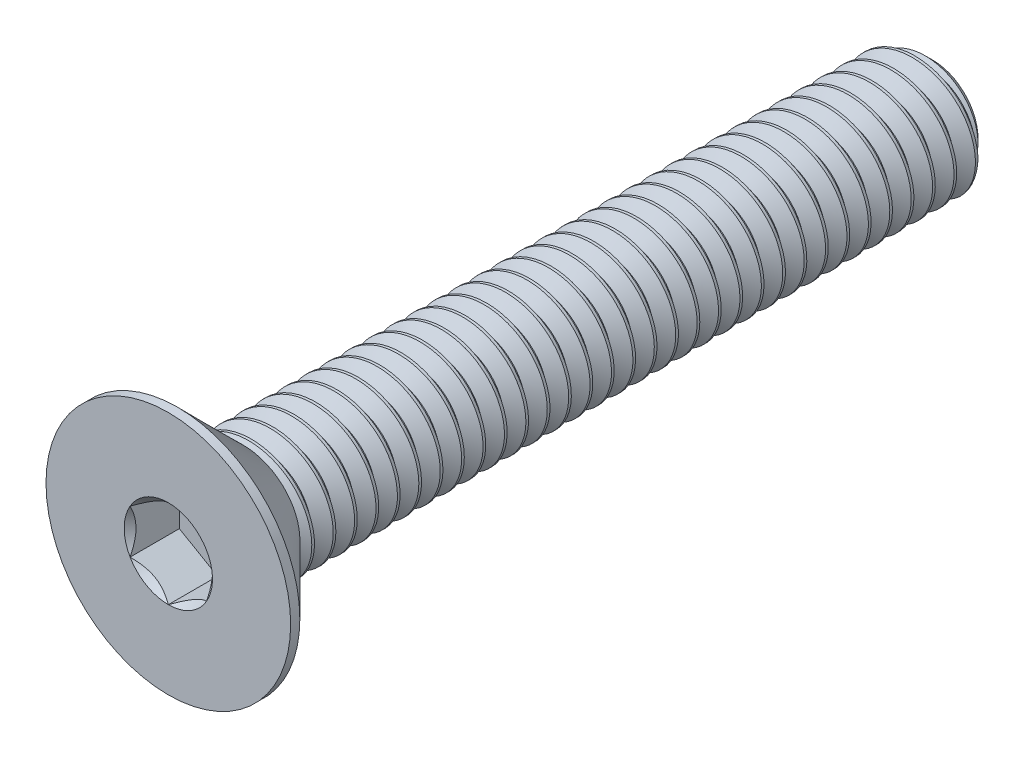
from build123d import *
from build123d.topology import SkipClean

# Parameters (mm, degrees)
SKETCH1_W          = 25
SKETCH1_H          = 2
CHAMFER1_SIZE      = 0.525
CUT_SWEEP1_PITCH   = 0.7
CUT_EXTRUDE2_DEPTH = 1.61


with BuildPart() as part:
    # Sketch1 → Revolve1 (revolve)
    with BuildSketch(Plane(origin=(0, 0, 0), x_dir=(0, 0, -1), z_dir=(1, 0, 0))):
        with Locations((12.5, 1)):
            Rectangle(SKETCH1_W, SKETCH1_H)
    revolve(axis=Axis((0, 0, -25), (0, 0, 1)))

    # Chamfer1
    chamfer1_edges = [part.edges().sort_by_distance(p)[0] for p in [
        (0, -2, -25),
    ]]
    chamfer(chamfer1_edges, length=CHAMFER1_SIZE)

    # Cut-Sweep1: arcs per turn and ends read off the stored shape
    # Cut-Sweep1: the profile of Sketch2 profile screwed along a right-hand helix through 36.666667 turns, 6 arcs to a turn; built about Z, then put on its axis
    cut_sweep1_z = Axis((0, 0, 0), (0, 0, 1))
    cut_sweep1_corners = [(2.0003, 0, 0.000173205), (2.0003, 0, -0.612673205), (1.545336663, 0, -0.35), (1.545336663, 0, -0.2625)]
    with BuildLine(mode=Mode.PRIVATE) as cut_sweep1_profile:
        Line(cut_sweep1_corners[0], cut_sweep1_corners[1])
        Line(cut_sweep1_corners[1], cut_sweep1_corners[2])
        Line(cut_sweep1_corners[2], cut_sweep1_corners[3])
        Line(cut_sweep1_corners[3], cut_sweep1_corners[0])
    cut_sweep1_cap = Face(cut_sweep1_profile.wire())
    cut_sweep1_turn_angles = [0, 30, 60, 90, 120, 150, 180, 210, 240, 270, 300, 330, 360]
    cut_sweep1_turn_weights = [1, 0.8660254037844387, 1, 0.8660254037844387, 1, 0.8660254037844387, 1, 0.8660254037844387, 1, 0.8660254037844387, 1, 0.8660254037844387, 1]
    cut_sweep1_turn_rails = [Edge.make_bspline([Vector(p[0], p[1], 0).rotate(cut_sweep1_z, cut_sweep1_turn_angles[k]) / cut_sweep1_turn_weights[k] + Vector(0, 0, p[2] + CUT_SWEEP1_PITCH * cut_sweep1_turn_angles[k] / 360) for k in range(13)], [0, 0, 0, 1, 1, 2, 2, 3, 3, 4, 4, 5, 5, 6, 6, 6], 2, cut_sweep1_turn_weights) for p in cut_sweep1_corners]
    cut_sweep1_turn_sides = [Face.make_surface_from_curves(cut_sweep1_turn_rails[p[0]], cut_sweep1_turn_rails[p[1]]) for p in [(0, 1), (1, 2), (2, 3), (3, 0)]]
    cut_sweep1_last_angles = [12960, 12990, 13020, 13050, 13080, 13110, 13140, 13170, 13200]
    cut_sweep1_last_weights = [1, 0.8660254037844387, 1, 0.8660254037844387, 1, 0.8660254037844387, 1, 0.8660254037844387, 1]
    cut_sweep1_last_rails = [Edge.make_bspline([Vector(p[0], p[1], 0).rotate(cut_sweep1_z, cut_sweep1_last_angles[k]) / cut_sweep1_last_weights[k] + Vector(0, 0, p[2] + CUT_SWEEP1_PITCH * cut_sweep1_last_angles[k] / 360) for k in range(9)], [0, 0, 0, 1, 1, 2, 2, 3, 3, 4, 4, 4], 2, cut_sweep1_last_weights) for p in cut_sweep1_corners]
    cut_sweep1_last_sides = [Face.make_surface_from_curves(cut_sweep1_last_rails[p[0]], cut_sweep1_last_rails[p[1]]) for p in [(0, 1), (1, 2), (2, 3), (3, 0)]]
    cut_sweep1 = Plane(origin=(0, 0, -25), x_dir=(0, 1, 0), z_dir=(0, 0, 1)) * Solid(Shell([*[p.moved(Location((0, 0, CUT_SWEEP1_PITCH * i))) for i in range(36) for p in cut_sweep1_turn_sides], *cut_sweep1_last_sides, cut_sweep1_cap, cut_sweep1_cap.rotate(cut_sweep1_z, 13200).moved(Location((0, 0, CUT_SWEEP1_PITCH * 13200 / 360)))]))
    add(cut_sweep1, mode=Mode.SUBTRACT)

    # Sketch7 → Revolve2 (revolve)
    with BuildSketch(Plane(origin=(0, 0, 0), x_dir=(0, 0, -1), z_dir=(1, 0, 0)), mode=Mode.PRIVATE) as revolve2_sk:
        Polygon((0, 4), (0.3, 4), (2.3, 2), (2.3, 0), (0, 0), align=None)
    revolve(revolve2_sk.sketch.rotate(Axis((0, 0, 0), (0, 0, -1)), 189.336081704), axis=Axis((0, 0, 0), (0, 0, -1)))

    # Boss-Extrude1 cone 1 section (through the dimple's axis) → Boss-Extrude1 (revolve)
    with SkipClean():  # the faces are left unmerged after this step: merging them gives an invalid solid
        with BuildSketch(Plane(origin=(0, 0, -2.3), x_dir=(0, -1, 0), z_dir=(1, 0, 0))):
            Polygon((0, 0), (2, 0), (0, 2), align=None)
        revolve(axis=Axis((0, 0, -2.3), (0, 0, -1)))

    # Sketch5 → Cut-Extrude2 (cut)
    with SkipClean():  # the faces are left unmerged after this step: merging them gives an invalid solid
        with BuildSketch(Plane.XY):
            Polygon((1.25, -0.721687836), (1.25, 0.721687836), (0, 1.443375673), (-1.25, 0.721687836), (-1.25, -0.721687836), (0, -1.443375673), align=None)
        extrude(amount=-CUT_EXTRUDE2_DEPTH, mode=Mode.SUBTRACT)

    # Cut-Extrude3 cone 1 section (through the dimple's axis) → Cut-Extrude3 (revolve, cut)
    with SkipClean():  # the faces are left unmerged after this step: merging them gives an invalid solid
        with BuildSketch(Plane(origin=(0, 0, 0), x_dir=(0, -1, 0), z_dir=(1, 0, 0))):
            Polygon((0, 0), (1.443375673, 0), (0, 1.443375673), align=None)
        revolve(axis=Axis((0, 0, 0), (0, 0, -1)), mode=Mode.SUBTRACT)


solid = part.part
